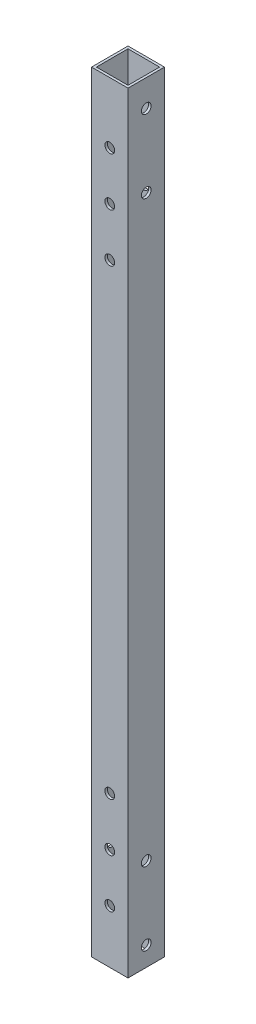
from build123d import *

# Parameters (mm, degrees)
SKETCH_1_W          = 15
SKETCH_1_H          = 15
SKETCH_1_W_2        = 13
SKETCH_1_H_2        = 13
EXTRUDE_1_DEPTH     = 320
SKETCH_3_R          = 2
CUT_EXTRUDE_2_DEPTH = 321.43915179
SKETCH_4_R          = 2
CUT_EXTRUDE_3_DEPTH = 321.43915179
SKETCH_7_W          = 15
SKETCH_7_H          = 3
CUT_EXTRUDE_6_DEPTH = 20


with BuildPart() as part:
    # 草图1 → 凸台-拉伸1 (new body)
    with BuildSketch(Plane(origin=(0, 0, 0), x_dir=(1, 0, 0), z_dir=(0, 1, 0))):
        Rectangle(SKETCH_1_W, SKETCH_1_H)
        Rectangle(SKETCH_1_W_2, SKETCH_1_H_2, mode=Mode.SUBTRACT)
    extrude(amount=EXTRUDE_1_DEPTH)

    # 草图3 → 切除-拉伸2 (cut, through all)
    with BuildSketch(Plane.XY.offset(7.5)):
        with Locations((0, 295)):
            Circle(SKETCH_3_R)
        with Locations((0, 275)):
            Circle(SKETCH_3_R)
        with Locations((0, 45)):
            Circle(SKETCH_3_R)
        with Locations((0, 25)):
            Circle(SKETCH_3_R)
        with Locations((0, 255)):
            Circle(SKETCH_3_R)
        with Locations((0, 65)):
            Circle(SKETCH_3_R)
    extrude(amount=-CUT_EXTRUDE_2_DEPTH, mode=Mode.SUBTRACT)

    # 草图4 → 切除-拉伸3 (cut, through all)
    with BuildSketch(Plane.ZY.offset(7.5)):
        with Locations((0, 11)):
            Circle(SKETCH_4_R)
        with Locations((0, 41)):
            Circle(SKETCH_4_R)
        with Locations((0, 279)):
            Circle(SKETCH_4_R)
        with Locations((0, 309)):
            Circle(SKETCH_4_R)
    extrude(amount=-CUT_EXTRUDE_3_DEPTH, mode=Mode.SUBTRACT)

    # 草图7 → 切除-拉伸6 (cut)
    with BuildSketch(Plane(origin=(7.5, 0, 0), x_dir=(0, 0, -1), z_dir=(1, 0, 0))):
        with Locations((0, 1.5)):
            Rectangle(SKETCH_7_W, SKETCH_7_H)
    extrude(amount=-CUT_EXTRUDE_6_DEPTH, mode=Mode.SUBTRACT)


solid = part.part
